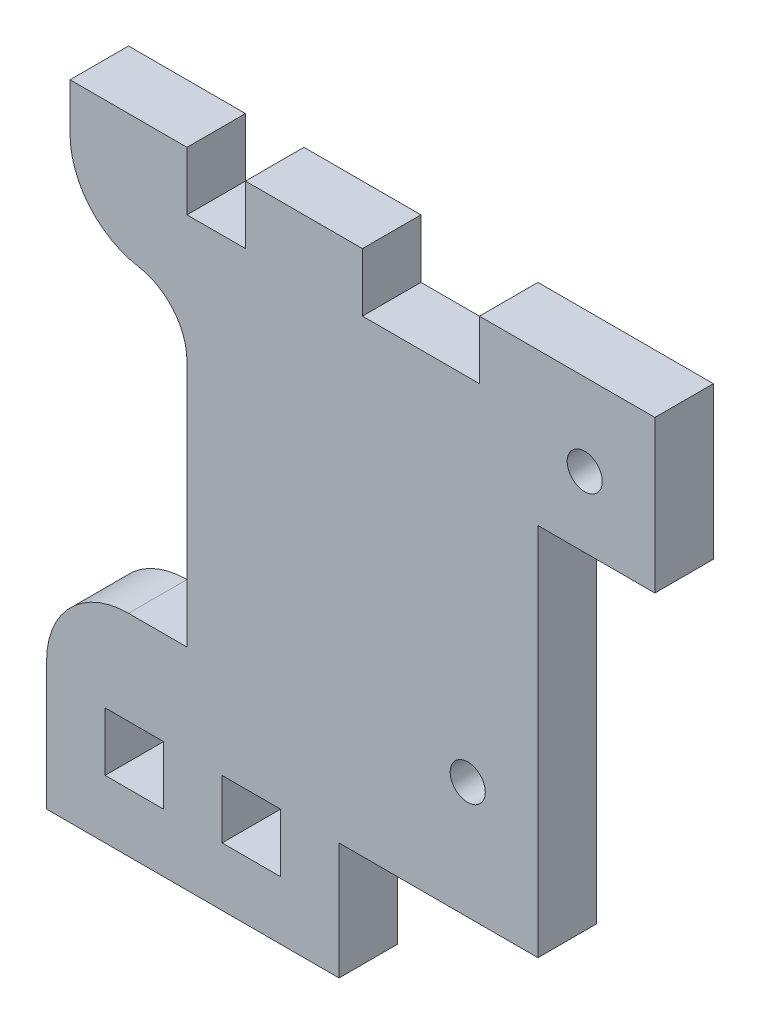
from build123d import *

# Parameters (mm, degrees)
ESQUISSE1_R        = 1.5
ESQUISSE1_W        = 5
ESQUISSE1_H        = 5
BOSS_EXTRU_1_DEPTH = 5
CONG_1_R           = 7
CONG_2_R           = 5


with BuildPart() as part:
    # Esquisse1 → Boss.-Extru.1 (new body)
    with BuildSketch(Plane.XY):
        Polygon((25, 0), (42, 0), (42, 32), (52, 32), (52, 45), (37, 45), (37, 40), (27, 40), (27, 45), (17, 45), (17, 40), (12, 40), (12, 45), (2, 45), (2, 40), (2, 34), (12, 34), (12, 8), (0, 8), (0, 0), (0, -5.810046935), (0, -10), (25, -10), (25, -4.928993292), align=None)
        with Locations((46, 38)):
            Circle(ESQUISSE1_R, mode=Mode.SUBTRACT)
        with Locations((36, 10)):
            Circle(ESQUISSE1_R, mode=Mode.SUBTRACT)
        with Locations((7.5, -2.5)):
            Rectangle(ESQUISSE1_W, ESQUISSE1_H, mode=Mode.SUBTRACT)
        with Locations((17.5, -2.5)):
            Rectangle(ESQUISSE1_W, ESQUISSE1_H, mode=Mode.SUBTRACT)
    extrude(amount=BOSS_EXTRU_1_DEPTH)

    # Congé1
    cong_1_edges = [part.edges().sort_by_distance(p)[0] for p in [
        (0, 8, 2.5),
        (2, 34, 2.5),
    ]]
    fillet(cong_1_edges, radius=CONG_1_R)

    # Congé2
    cong_2_edges = [part.edges().sort_by_distance(p)[0] for p in [
        (12, 34, 2.5),
    ]]
    fillet(cong_2_edges, radius=CONG_2_R)


solid = part.part
